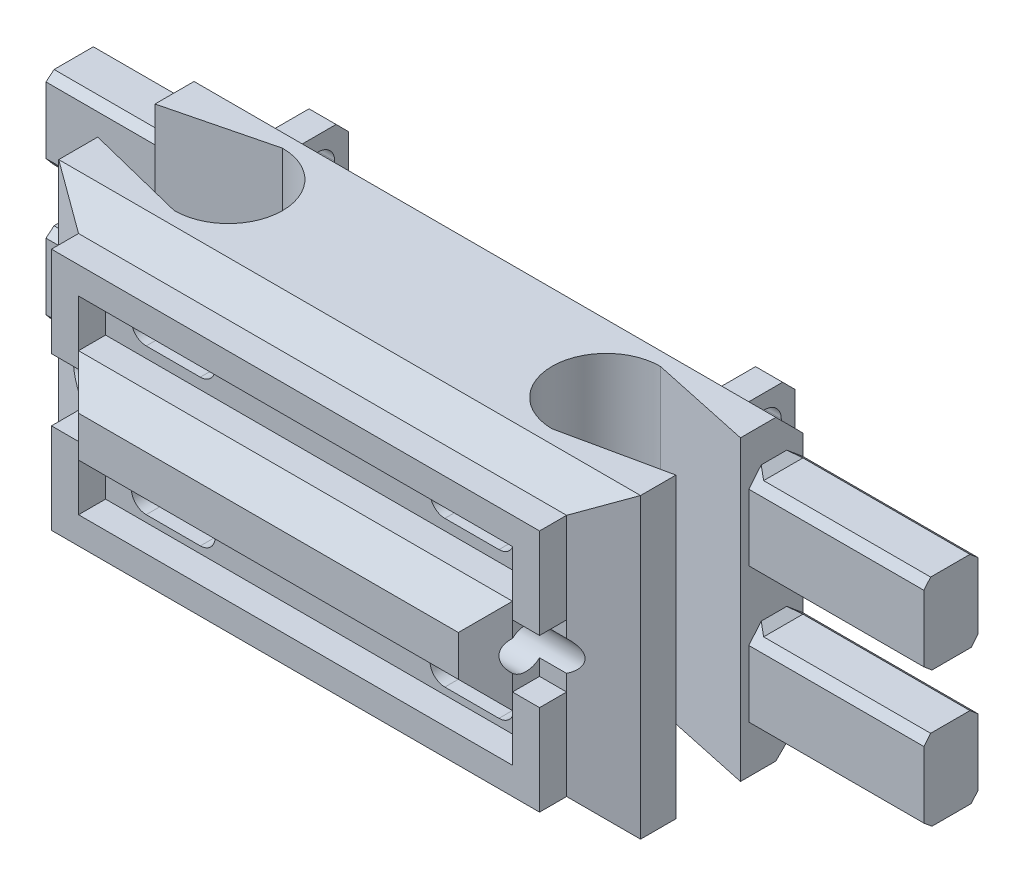
from build123d import *
from OCP.BRepFilletAPI import BRepFilletAPI_MakeChamfer

# Parameters (mm, degrees)
BASE_W                  = 21.5
BASE_H                  = 11
BOSS_EXTRUDE1_DEPTH     = 7
CHAMFER4_SIZE           = 1
CHAMFER5_SIZE           = 1
CHAMFER5_SIZE2          = 1.732050808
CHAMFER6_SIZE           = 1
SKETCH8_W               = 16.035898384
SKETCH8_H               = 3.5
BOSS_EXTRUDE5_DEPTH     = 2
CUT_EXTRUDE5_DEPTH      = 4.254422658
CUT_EXTRUDE5_DEPTH_BACK = 34.5
SKETCH9_R               = 0.75
CHAMFER9_SIZE           = 1
SKETCH13_W              = 4.75
SKETCH13_H              = 3.5
BOSS_EXTRUDE6_DEPTH     = 2
CHAMFER10_SIZE          = 1
CUT_EXTRUDE6_DEPTH      = 3
CUT_EXTRUDE6_DEPTH_BACK = 30
SKETCH14_R              = 0.75
SKETCH15_W              = 1
SKETCH15_H              = 3.75
BOSS_EXTRUDE7_DEPTH     = 2
CUT_EXTRUDE7_DEPTH      = 26
CHAMFER11_SIZE          = 0.3
CHAMFER12_SIZE          = 0.75
CUT_EXTRUDE8_DEPTH      = 11
SKETCH18_W              = 2
SKETCH18_H              = 3
BOSS_EXTRUDE8_DEPTH     = 6.47
CHAMFER13_SIZE          = 0.25
CHAMFER13_SIZE2         = 0.297938398
CHAMFER14_SIZE          = 0.25
CHAMFER14_SIZE2         = 0.297938398
SKETCH19_W              = 2
SKETCH19_H              = 3
BOSS_EXTRUDE9_DEPTH     = 4.47
CHAMFER15_SIZE          = 0.25
CHAMFER15_SIZE2         = 0.297938398
CHAMFER16_SIZE          = 0.25
CHAMFER16_SIZE2         = 0.297938398
SKETCH20_W              = 1
SKETCH20_H              = 2.345491503
SKETCH20_W_2            = 18.035898384
SKETCH20_H_2            = 1
BOSS_EXTRUDE10_DEPTH    = 1
CUT_EXTRUDE9_DEPTH      = 1


with BuildPart() as part:
    # Base → Boss-Extrude1 (new body)
    with BuildSketch(Plane.XY):
        with Locations((10.75, 5.5)):
            Rectangle(BASE_W, BASE_H)
    extrude(amount=BOSS_EXTRUDE1_DEPTH)

    # Chamfer4
    chamfer4_edges = [part.edges().sort_by_distance(p)[0] for p in [
        (10.75, 11, 7),
        (10.75, 0, 7),
    ]]
    chamfer(chamfer4_edges, length=CHAMFER4_SIZE)

    # Chamfer5: one chamfer whose edges measure the first distance from different faces: ONE call of the kernel's chamfer builder (chamfer() names one face for all edges)
    chamfer5_edges_1 = [part.edges().sort_by_distance(p)[0] for p in [
        (0, 5.5, 7),
    ]]
    chamfer5_side_1 = [part.faces().sort_by_distance(p)[0] for p in [
        (0, 5.5, 3.458333333),
    ]]
    chamfer5_edges_2 = [part.edges().sort_by_distance(p)[0] for p in [
        (21.5, 5.5, 7),
    ]]
    chamfer5_side_2 = [part.faces().sort_by_distance(p)[0] for p in [
        (21.5, 5.5, 3.458333333),
    ]]
    chamfer5 = BRepFilletAPI_MakeChamfer(part.part.solid().wrapped)
    for e in chamfer5_edges_1:
        chamfer5.Add(CHAMFER5_SIZE, CHAMFER5_SIZE2, e.wrapped, chamfer5_side_1[0].wrapped)  # the first distance lies on this face
    for e in chamfer5_edges_2:
        chamfer5.Add(CHAMFER5_SIZE, CHAMFER5_SIZE2, e.wrapped, chamfer5_side_2[0].wrapped)  # the first distance lies on this face
    add(Compound.cast(chamfer5.Shape()), mode=Mode.REPLACE)

    # Chamfer6
    chamfer6_edges = [part.edges().sort_by_distance(p)[0] for p in [
        (10.75, 11, 0),
        (10.75, 0, 0),
    ]]
    chamfer(chamfer6_edges, length=CHAMFER6_SIZE)

    # Sketch8 → Boss-Extrude5 (add)
    with BuildSketch(Plane.XY.offset(7)):
        with Locations((10.75, 5.5)):
            Rectangle(SKETCH8_W, SKETCH8_H)
    extrude(amount=BOSS_EXTRUDE5_DEPTH)

    # Sketch9 → Cut-Extrude5 (cut, two sides: drawn at the far end of the back side and taken through both)
    with BuildSketch(Plane(origin=(18.767949192, 0, 0), x_dir=(0, 0, -1), z_dir=(1, 0, 0)).offset(-CUT_EXTRUDE5_DEPTH_BACK)):
        with Locations(Location((-7.5, 5.5, 0), (0, 0, 311.810314896))):
            Circle(SKETCH9_R)
    extrude(amount=CUT_EXTRUDE5_DEPTH + CUT_EXTRUDE5_DEPTH_BACK, mode=Mode.SUBTRACT)

    # Chamfer9
    # the kernel refuses this chamfer: 1 mm, written as the material it takes off along each edge
    with BuildSketch(Plane(origin=(21.33963218, 3.75, 9), x_dir=(0, -0.027495876610586487, -0.9996219169112968), z_dir=(-1, 0, 0)), Plane(origin=(0.16036782, 7.25, 9), x_dir=(0, 0.027495876610586487, -0.9996219169112968), z_dir=(1, 0, 0))) as chamfer9_piece_1:
        Polygon((CHAMFER9_SIZE * 0.999621916911, -CHAMFER9_SIZE * 0.0274958766106), (-CHAMFER9_SIZE * 0.0274958766106, -CHAMFER9_SIZE * 0.999621916911), (0, 0), align=None)
    extrude(amount=21.179264361, mode=Mode.SUBTRACT)
    with BuildSketch(Plane(origin=(18.767949192, 9.821682988, 9), x_dir=(0.027495876610585623, 0, -0.9996219169112968), z_dir=(0, -1, 0)), Plane(origin=(2.732050808, 1.178317012, 9), x_dir=(-0.027495876610586487, 0, -0.9996219169112968), z_dir=(0, 1, 0))) as chamfer9_piece_2:
        Polygon((CHAMFER9_SIZE * 0.999621916911, -CHAMFER9_SIZE * 0.0274958766106), (-CHAMFER9_SIZE * 0.0274958766106, -CHAMFER9_SIZE * 0.999621916911), (0, 0), align=None)
    extrude(amount=8.643365976, mode=Mode.SUBTRACT)

    # Sketch13 → Boss-Extrude6 (add)
    with BuildSketch(Plane(origin=(0, 0, 0), x_dir=(-1, 0, 0), z_dir=(0, 0, -1))):
        with Locations((-3.375, 5.5)):
            Rectangle(SKETCH13_W, SKETCH13_H)
        with Locations((-18.125, 5.5)):
            Rectangle(SKETCH13_W, SKETCH13_H)
    extrude(amount=BOSS_EXTRUDE6_DEPTH)

    # Chamfer10
    chamfer10_edges = [part.edges().sort_by_distance(p)[0] for p in [
        (18.125, 7.25, -2),
        (20.5, 5.5, -2),
        (18.125, 3.75, -2),
        (15.75, 5.5, -2),
        (5.75, 5.5, -2),
        (3.375, 3.75, -2),
        (1, 5.5, -2),
        (3.375, 7.25, -2),
    ]]
    chamfer(chamfer10_edges, length=CHAMFER10_SIZE)

    # Sketch14 → Cut-Extrude6 (cut, two sides: drawn at the far end of the back side and taken through both)
    with BuildSketch(Plane.ZY.offset(-1).offset(-CUT_EXTRUDE6_DEPTH_BACK)):
        with Locations(Location((-0.5, 5.5, 0), (0, 0, 131.810314896))):
            Circle(SKETCH14_R)
    extrude(amount=CUT_EXTRUDE6_DEPTH + CUT_EXTRUDE6_DEPTH_BACK, mode=Mode.SUBTRACT)

    # Sketch15 → Boss-Extrude7 (add)
    with BuildSketch(Plane(origin=(0, 0, 0), x_dir=(-1, 0, 0), z_dir=(0, 0, -1))):
        with Locations((-19, 2.875)):
            Rectangle(SKETCH15_W, SKETCH15_H)
        with Locations((-19, 8.125)):
            Rectangle(SKETCH15_W, SKETCH15_H)
        with Locations((-2.5, 2.875)):
            Rectangle(SKETCH15_W, SKETCH15_H)
        with Locations((-2.5, 8.125)):
            Rectangle(SKETCH15_W, SKETCH15_H)
    extrude(amount=BOSS_EXTRUDE7_DEPTH)

    # Sketch16 → Cut-Extrude7 (cut)
    with BuildSketch(Plane(origin=(19.5, 0, 0), x_dir=(0, 0, -1), z_dir=(1, 0, 0))):
        with BuildLine():
            Line((1.2, 3.15), (1.2, 2.15))
            ThreePointArc((1.2, 2.15), (0.6, 1.55), (0, 2.15))
            Line((0, 2.15), (0, 3.15))
            ThreePointArc((0, 3.15), (0.6, 3.75), (1.2, 3.15))
        make_face()
        with BuildLine():
            Line((0, 7.85), (0, 8.85))
            ThreePointArc((0, 8.85), (0.6, 9.45), (1.2, 8.85))
            Line((1.2, 8.85), (1.2, 7.85))
            ThreePointArc((1.2, 7.85), (0.6, 7.25), (0, 7.85))
        make_face()
    extrude(amount=-CUT_EXTRUDE7_DEPTH, mode=Mode.SUBTRACT)

    # Chamfer11
    chamfer11_edges = [part.edges().sort_by_distance(p)[0] for p in [
        (19.5, 2.875, -2),
        (18.5, 2.875, -2),
        (2, 2.875, -2),
        (3, 2.875, -2),
        (19.5, 8.125, -2),
        (18.5, 8.125, -2),
        (2, 8.125, -2),
        (3, 8.125, -2),
    ]]
    chamfer(chamfer11_edges, length=CHAMFER11_SIZE)

    # Chamfer12
    chamfer12_edges = [part.edges().sort_by_distance(p)[0] for p in [
        (19, 1, -2),
        (19, 10, -2),
        (2.5, 10, -2),
        (2.5, 1, -2),
    ]]
    chamfer(chamfer12_edges, length=CHAMFER12_SIZE)

    # Tendon extrude → Cut-Extrude8 (cut)
    with BuildSketch(Plane.XZ):
        with BuildLine():
            Line((0, 4.5575), (0, 2.4425))
            Line((0, 2.4425), (3.77, 1.5))
            ThreePointArc((3.77, 1.5), (5.77, 3.5), (3.77, 5.5))
            Line((3.77, 5.5), (0, 4.5575))
        make_face()
        with BuildLine():
            Line((21.5, 2.307857143), (21.5, 4.692142857))
            Line((21.5, 4.692142857), (17.73, 5.5))
            ThreePointArc((17.73, 5.5), (15.73, 3.5), (17.73, 1.5))
            Line((17.73, 1.5), (21.5, 2.307857143))
        make_face()
    extrude(amount=-CUT_EXTRUDE8_DEPTH, mode=Mode.SUBTRACT)

    # Sketch18 → Boss-Extrude8 (add)
    with BuildSketch(Plane(origin=(21.5, 0, 0), x_dir=(0, 0, -1), z_dir=(1, 0, 0))):
        with Locations((-1, 8)):
            Rectangle(SKETCH18_W, SKETCH18_H)
        with Locations((-1, 3)):
            Rectangle(SKETCH18_W, SKETCH18_H)
    extrude(amount=BOSS_EXTRUDE8_DEPTH)

    # Chamfer13: one chamfer whose edges measure the first distance from different faces: ONE call of the kernel's chamfer builder (chamfer() names one face for all edges)
    chamfer13_edges_1 = [part.edges().sort_by_distance(p)[0] for p in [
        (24.735, 9.5, 2),
    ]]
    chamfer13_side_1 = [part.faces().sort_by_distance(p)[0] for p in [
        (24.735, 9.5, 1),
    ]]
    chamfer13_edges_2 = [part.edges().sort_by_distance(p)[0] for p in [
        (24.735, 6.5, 2),
    ]]
    chamfer13_side_2 = [part.faces().sort_by_distance(p)[0] for p in [
        (24.735, 8, 2),
    ]]
    chamfer13_edges_3 = [part.edges().sort_by_distance(p)[0] for p in [
        (24.735, 6.5, 0),
    ]]
    chamfer13_side_3 = [part.faces().sort_by_distance(p)[0] for p in [
        (24.735, 6.5, 1),
    ]]
    chamfer13_edges_4 = [part.edges().sort_by_distance(p)[0] for p in [
        (24.735, 9.5, 0),
    ]]
    chamfer13_side_4 = [part.faces().sort_by_distance(p)[0] for p in [
        (13.788828906, 8.167767518, 0),
    ]]
    chamfer13_edges_5 = [part.edges().sort_by_distance(p)[0] for p in [
        (24.735, 4.5, 2),
    ]]
    chamfer13_side_5 = [part.faces().sort_by_distance(p)[0] for p in [
        (24.735, 4.5, 1),
    ]]
    chamfer13_edges_6 = [part.edges().sort_by_distance(p)[0] for p in [
        (24.735, 1.5, 2),
    ]]
    chamfer13_side_6 = [part.faces().sort_by_distance(p)[0] for p in [
        (24.735, 3, 2),
    ]]
    chamfer13_edges_7 = [part.edges().sort_by_distance(p)[0] for p in [
        (24.735, 1.5, 0),
    ]]
    chamfer13_side_7 = [part.faces().sort_by_distance(p)[0] for p in [
        (24.735, 1.5, 1),
    ]]
    chamfer13_edges_8 = [part.edges().sort_by_distance(p)[0] for p in [
        (24.735, 4.5, 0),
    ]]
    chamfer13_side_8 = [part.faces().sort_by_distance(p)[0] for p in [
        (13.788828906, 2.832232482, 0),
    ]]
    chamfer13 = BRepFilletAPI_MakeChamfer(part.part.solid().wrapped)
    for e in chamfer13_edges_1:
        chamfer13.Add(CHAMFER13_SIZE, CHAMFER13_SIZE2, e.wrapped, chamfer13_side_1[0].wrapped)  # the first distance lies on this face
    for e in chamfer13_edges_2:
        chamfer13.Add(CHAMFER13_SIZE, CHAMFER13_SIZE2, e.wrapped, chamfer13_side_2[0].wrapped)  # the first distance lies on this face
    for e in chamfer13_edges_3:
        chamfer13.Add(CHAMFER13_SIZE, CHAMFER13_SIZE2, e.wrapped, chamfer13_side_3[0].wrapped)  # the first distance lies on this face
    for e in chamfer13_edges_4:
        chamfer13.Add(CHAMFER13_SIZE, CHAMFER13_SIZE2, e.wrapped, chamfer13_side_4[0].wrapped)  # the first distance lies on this face
    for e in chamfer13_edges_5:
        chamfer13.Add(CHAMFER13_SIZE, CHAMFER13_SIZE2, e.wrapped, chamfer13_side_5[0].wrapped)  # the first distance lies on this face
    for e in chamfer13_edges_6:
        chamfer13.Add(CHAMFER13_SIZE, CHAMFER13_SIZE2, e.wrapped, chamfer13_side_6[0].wrapped)  # the first distance lies on this face
    for e in chamfer13_edges_7:
        chamfer13.Add(CHAMFER13_SIZE, CHAMFER13_SIZE2, e.wrapped, chamfer13_side_7[0].wrapped)  # the first distance lies on this face
    for e in chamfer13_edges_8:
        chamfer13.Add(CHAMFER13_SIZE, CHAMFER13_SIZE2, e.wrapped, chamfer13_side_8[0].wrapped)  # the first distance lies on this face
    add(Compound.cast(chamfer13.Shape()), mode=Mode.REPLACE)

    # Chamfer14
    chamfer14_edges = [part.edges().sort_by_distance(p)[0] for p in [
        (21.5, 1.5, 0.976030801),
        (21.5, 4.5, 1.023969199),
        (21.5, 6.5, 0.976030801),
        (21.5, 9.5, 1.023969199),
    ]]
    chamfer14_side = [part.faces().sort_by_distance(p)[0] for p in [
        (21.5, 5.5, 1.3801438),
    ]]
    chamfer(chamfer14_edges, length=CHAMFER14_SIZE, length2=CHAMFER14_SIZE2, reference=chamfer14_side[0])

    # Sketch19 → Boss-Extrude9 (add)
    with BuildSketch(Plane.ZY):
        with Locations((1, 3)):
            Rectangle(SKETCH19_W, SKETCH19_H)
        with Locations((1, 8)):
            Rectangle(SKETCH19_W, SKETCH19_H)
    extrude(amount=BOSS_EXTRUDE9_DEPTH)

    # Chamfer15: one chamfer whose edges measure the first distance from different faces: ONE call of the kernel's chamfer builder (chamfer() names one face for all edges)
    chamfer15_edges_1 = [part.edges().sort_by_distance(p)[0] for p in [
        (-2.235, 4.5, 0),
    ]]
    chamfer15_side_1 = [part.faces().sort_by_distance(p)[0] for p in [
        (-2.235, 4.5, 1),
    ]]
    chamfer15_edges_2 = [part.edges().sort_by_distance(p)[0] for p in [
        (-2.235, 1.5, 0),
    ]]
    chamfer15_side_2 = [part.faces().sort_by_distance(p)[0] for p in [
        (11.231299834, 2.852751017, 0),
    ]]
    chamfer15_edges_3 = [part.edges().sort_by_distance(p)[0] for p in [
        (-2.235, 1.5, 2),
    ]]
    chamfer15_side_3 = [part.faces().sort_by_distance(p)[0] for p in [
        (-2.235, 1.5, 1),
    ]]
    chamfer15_edges_4 = [part.edges().sort_by_distance(p)[0] for p in [
        (-2.235, 4.5, 2),
    ]]
    chamfer15_side_4 = [part.faces().sort_by_distance(p)[0] for p in [
        (-2.235, 3, 2),
    ]]
    chamfer15_edges_5 = [part.edges().sort_by_distance(p)[0] for p in [
        (-2.235, 6.5, 0),
    ]]
    chamfer15_side_5 = [part.faces().sort_by_distance(p)[0] for p in [
        (11.231299834, 8.154916313, 0),
    ]]
    chamfer15_edges_6 = [part.edges().sort_by_distance(p)[0] for p in [
        (-2.235, 6.5, 2),
    ]]
    chamfer15_side_6 = [part.faces().sort_by_distance(p)[0] for p in [
        (-2.235, 6.5, 1),
    ]]
    chamfer15_edges_7 = [part.edges().sort_by_distance(p)[0] for p in [
        (-2.235, 9.5, 2),
    ]]
    chamfer15_side_7 = [part.faces().sort_by_distance(p)[0] for p in [
        (-2.235, 8, 2),
    ]]
    chamfer15_edges_8 = [part.edges().sort_by_distance(p)[0] for p in [
        (-2.235, 9.5, 0),
    ]]
    chamfer15_side_8 = [part.faces().sort_by_distance(p)[0] for p in [
        (-2.235, 9.5, 1),
    ]]
    chamfer15 = BRepFilletAPI_MakeChamfer(part.part.solid().wrapped)
    for e in chamfer15_edges_1:
        chamfer15.Add(CHAMFER15_SIZE, CHAMFER15_SIZE2, e.wrapped, chamfer15_side_1[0].wrapped)  # the first distance lies on this face
    for e in chamfer15_edges_2:
        chamfer15.Add(CHAMFER15_SIZE, CHAMFER15_SIZE2, e.wrapped, chamfer15_side_2[0].wrapped)  # the first distance lies on this face
    for e in chamfer15_edges_3:
        chamfer15.Add(CHAMFER15_SIZE, CHAMFER15_SIZE2, e.wrapped, chamfer15_side_3[0].wrapped)  # the first distance lies on this face
    for e in chamfer15_edges_4:
        chamfer15.Add(CHAMFER15_SIZE, CHAMFER15_SIZE2, e.wrapped, chamfer15_side_4[0].wrapped)  # the first distance lies on this face
    for e in chamfer15_edges_5:
        chamfer15.Add(CHAMFER15_SIZE, CHAMFER15_SIZE2, e.wrapped, chamfer15_side_5[0].wrapped)  # the first distance lies on this face
    for e in chamfer15_edges_6:
        chamfer15.Add(CHAMFER15_SIZE, CHAMFER15_SIZE2, e.wrapped, chamfer15_side_6[0].wrapped)  # the first distance lies on this face
    for e in chamfer15_edges_7:
        chamfer15.Add(CHAMFER15_SIZE, CHAMFER15_SIZE2, e.wrapped, chamfer15_side_7[0].wrapped)  # the first distance lies on this face
    for e in chamfer15_edges_8:
        chamfer15.Add(CHAMFER15_SIZE, CHAMFER15_SIZE2, e.wrapped, chamfer15_side_8[0].wrapped)  # the first distance lies on this face
    add(Compound.cast(chamfer15.Shape()), mode=Mode.REPLACE)

    # Chamfer16
    chamfer16_edges = [part.edges().sort_by_distance(p)[0] for p in [
        (0, 1.5, 1.023969199),
        (0, 4.5, 0.976030801),
        (0, 9.5, 0.976030801),
        (0, 6.5, 1.023969199),
    ]]
    chamfer16_side = [part.faces().sort_by_distance(p)[0] for p in [
        (0, 5.5, 1.485621458),
    ]]
    chamfer(chamfer16_edges, length=CHAMFER16_SIZE, length2=CHAMFER16_SIZE2, reference=chamfer16_side[0])

    # Sketch20 → Boss-Extrude10 (add)
    with BuildSketch(Plane.XY.offset(7)):
        Polygon((2.732050808, 9), (1.732050808, 9), (1.732050808, 6.654508497), (2.732050808, 6.654508497), (2.732050808, 7.25), align=None)
        Polygon((19.767949192, 10), (1.732050808, 10), (1.732050808, 9), (2.732050808, 9), (18.767949192, 9), (19.767949192, 9), align=None)
        Polygon((19.767949192, 6.654508497), (19.767949192, 9), (18.767949192, 9), (18.767949192, 7.25), (18.767949192, 6.654508497), align=None)
        with Locations((19.267949192, 3.172745751)):
            Rectangle(SKETCH20_W, SKETCH20_H)
        with Locations((10.75, 1.5)):
            Rectangle(SKETCH20_W_2, SKETCH20_H_2)
        with Locations((2.232050808, 3.172745751)):
            Rectangle(SKETCH20_W, SKETCH20_H)
    extrude(amount=BOSS_EXTRUDE10_DEPTH)

    # Sketch21 → Cut-Extrude9 (cut)
    with BuildSketch(Plane.XY.offset(7)):
        with BuildLine():
            Line((4.232050808, 8.746865984), (6.232050808, 8.746865984))
            ThreePointArc((6.232050808, 8.746865984), (6.778916791, 8.2), (6.232050808, 7.653134016))
            Line((6.232050808, 7.653134016), (4.232050808, 7.653134016))
            ThreePointArc((4.232050808, 7.653134016), (3.685184824, 8.2), (4.232050808, 8.746865984))
        make_face()
        with BuildLine():
            Line((15.267949192, 8.746865984), (17.267949192, 8.746865984))
            ThreePointArc((17.267949192, 8.746865984), (17.814815176, 8.2), (17.267949192, 7.653134016))
            Line((17.267949192, 7.653134016), (15.267949192, 7.653134016))
            ThreePointArc((15.267949192, 7.653134016), (14.721083209, 8.2), (15.267949192, 8.746865984))
        make_face()
        with BuildLine():
            Line((15.267949192, 3.346865984), (17.267949192, 3.346865984))
            ThreePointArc((17.267949192, 3.346865984), (17.814815176, 2.8), (17.267949192, 2.253134016))
            Line((17.267949192, 2.253134016), (15.267949192, 2.253134016))
            ThreePointArc((15.267949192, 2.253134016), (14.721083209, 2.8), (15.267949192, 3.346865984))
        make_face()
        with BuildLine():
            Line((6.232050808, 2.253134016), (4.232050808, 2.253134016))
            ThreePointArc((4.232050808, 2.253134016), (3.685184824, 2.8), (4.232050808, 3.346865984))
            Line((4.232050808, 3.346865984), (6.232050808, 3.346865984))
            ThreePointArc((6.232050808, 3.346865984), (6.778916791, 2.8), (6.232050808, 2.253134016))
        make_face()
    extrude(amount=-CUT_EXTRUDE9_DEPTH, mode=Mode.SUBTRACT)


solid = part.part
